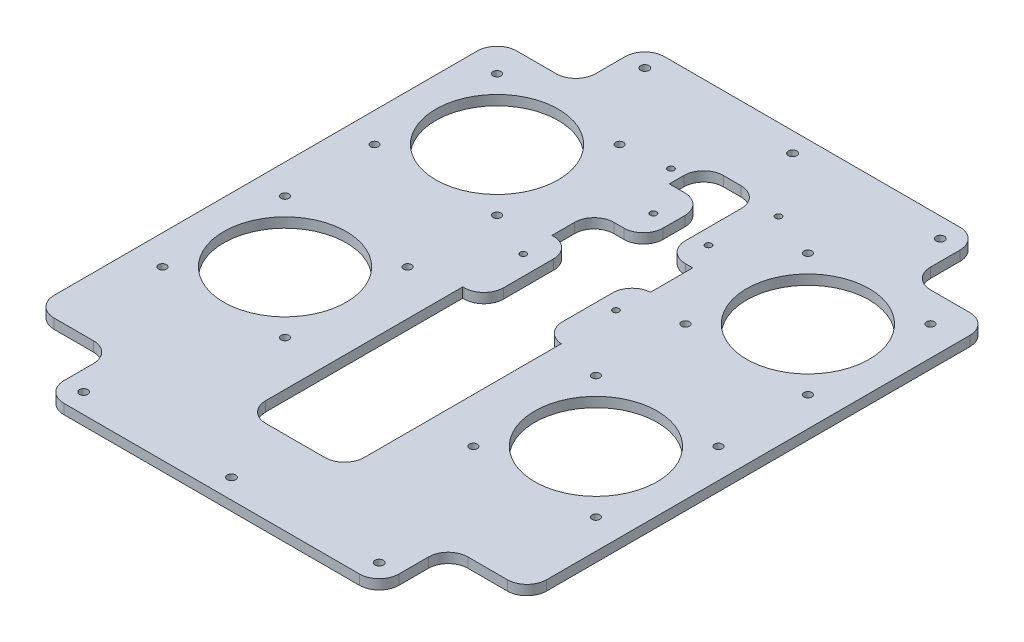
from build123d import *

# Parameters (mm, degrees)
SKETCH1_W           = 279.4
SKETCH1_H           = 304.8
BOSS_EXTRUDE1_DEPTH = 5
CUT_EXTRUDE1_DEPTH  = 10
SKETCH3_R           = 2.125
CUT_EXTRUDE2_DEPTH  = 198.169368818
SKETCH6_R           = 2
SKETCH6_R_2         = 31.1
CUT_EXTRUDE3_DEPTH  = 198.169368818
SKETCH5_R           = 1.5875
CUT_EXTRUDE4_DEPTH  = 10
FILLET1_R           = 10


with BuildPart() as part:
    # Sketch1 → Boss-Extrude1 (new body)
    with BuildSketch(Plane(origin=(0, 0, 0), x_dir=(1, 0, 0), z_dir=(0, 1, 0))):
        Rectangle(SKETCH1_W, SKETCH1_H)
    extrude(amount=BOSS_EXTRUDE1_DEPTH)

    # Sketch2 → Cut-Extrude1 (cut)
    with BuildSketch(Plane(origin=(0, 5, 0), x_dir=(1, 0, 0), z_dir=(0, 1, 0))):
        Polygon((-139.7, 152.4), (-85, 152.4), (-85, 117.4), (-125, 117.4), (-125, -117.4), (-85, -117.4), (-85, -152.4), (-139.7, -152.4), align=None)
        Polygon((139.7, -152.4), (85, -152.4), (85, -117.4), (125, -117.4), (125, 117.4), (85, 117.4), (85, 152.4), (139.7, 152.4), align=None)
    extrude(amount=-CUT_EXTRUDE1_DEPTH, mode=Mode.SUBTRACT)

    # Sketch3 → Cut-Extrude2 (cut, through all)
    with BuildSketch(Plane(origin=(0, 5, 0), x_dir=(1, 0, 0), z_dir=(0, 1, 0))):
        with Locations(Location((-75, 142.4, 0), (0, 0, 270))):
            Circle(SKETCH3_R)
        with Locations(Location((75, 142.4, 0), (0, 0, 270))):
            Circle(SKETCH3_R)
        with Locations(Location((75, -142.4, 0), (0, 0, 270))):
            Circle(SKETCH3_R)
        with Locations(Location((-75, -142.4, 0), (0, 0, 270))):
            Circle(SKETCH3_R)
        with Locations(Location((0, 142.4, 0), (0, 0, 270))):
            Circle(SKETCH3_R)
        with Locations(Location((0, -142.4, 0), (0, 0, 270))):
            Circle(SKETCH3_R)
    extrude(amount=-CUT_EXTRUDE2_DEPTH, mode=Mode.SUBTRACT)

    # Sketch6 → Cut-Extrude3 (cut, through all)
    with BuildSketch(Plane(origin=(0, 5, 0), x_dir=(1, 0, 0), z_dir=(0, 1, 0))):
        with Locations(Location((-110, 102.4, 0), (0, 0, 270))):
            Circle(SKETCH6_R)
        with Locations(Location((-47.8, 102.4, 0), (0, 0, 270))):
            Circle(SKETCH6_R)
        with Locations(Location((-47.8, 40.2, 0), (0, 0, 270))):
            Circle(SKETCH6_R)
        with Locations(Location((-110, 40.2, 0), (0, 0, 270))):
            Circle(SKETCH6_R)
        with Locations(Location((-110, -5.2, 0), (0, 0, 270))):
            Circle(SKETCH6_R)
        with Locations(Location((-47.8, -5.2, 0), (0, 0, 270))):
            Circle(SKETCH6_R)
        with Locations(Location((-47.8, -67.4, 0), (0, 0, 270))):
            Circle(SKETCH6_R)
        with Locations(Location((-110, -67.4, 0), (0, 0, 270))):
            Circle(SKETCH6_R)
        with Locations(Location((-78.9, 71.3, 0), (0, 0, 270))):
            Circle(SKETCH6_R_2)
        with Locations(Location((-78.9, -36.3, 0), (0, 0, 270))):
            Circle(SKETCH6_R_2)
        with Locations(Location((78.9, -36.3, 0), (0, 0, 90))):
            Circle(SKETCH6_R_2)
        with Locations(Location((78.9, 71.3, 0), (0, 0, 90))):
            Circle(SKETCH6_R_2)
        with Locations(Location((110, -67.4, 0), (0, 0, 90))):
            Circle(SKETCH6_R)
        with Locations(Location((47.8, -67.4, 0), (0, 0, 90))):
            Circle(SKETCH6_R)
        with Locations(Location((47.8, -5.2, 0), (0, 0, 90))):
            Circle(SKETCH6_R)
        with Locations(Location((110, -5.2, 0), (0, 0, 90))):
            Circle(SKETCH6_R)
        with Locations(Location((110, 40.2, 0), (0, 0, 90))):
            Circle(SKETCH6_R)
        with Locations(Location((47.8, 40.2, 0), (0, 0, 90))):
            Circle(SKETCH6_R)
        with Locations(Location((47.8, 102.4, 0), (0, 0, 90))):
            Circle(SKETCH6_R)
        with Locations(Location((110, 102.4, 0), (0, 0, 90))):
            Circle(SKETCH6_R)
    extrude(amount=-CUT_EXTRUDE3_DEPTH, mode=Mode.SUBTRACT)

    # Sketch5 → Cut-Extrude4 (cut)
    with BuildSketch(Plane(origin=(0, 5, 0), x_dir=(1, 0, 0), z_dir=(0, 1, 0))):
        with Locations(Location((24.120614372, 111.137541604, 0), (0, 0, 270))):
            Circle(SKETCH5_R)
        with Locations(Location((-24.139385628, 104.787541604, 0), (0, 0, 270))):
            Circle(SKETCH5_R)
        with Locations(Location((-8.899385628, 80.657541604, 0), (0, 0, 270))):
            Circle(SKETCH5_R)
        with Locations(Location((19.040614372, 80.657541604, 0), (0, 0, 270))):
            Circle(SKETCH5_R)
        with Locations(Location((24.120614372, 28.587541604, 0), (0, 0, 270))):
            Circle(SKETCH5_R)
        with Locations(Location((-24.139385628, 29.857541604, 0), (0, 0, 270))):
            Circle(SKETCH5_R)
        Polygon((0, 66.727836804), (-25, 66.727836804), (-25, 45.310060528), (-14.26649767, 45.310060528), (-14.26649767, 0), (-25, 0), (-25, -110), (25, -110), (25, 0), (15.644534715, 0), (15.644534715, 45.310060528), (25, 45.310060528), (25, 66.727836804), (11.213270658, 66.727836804), (11.213270658, 115.102469427), (0, 115.102469427), (-17.849370469, 115.102469427), (-17.849370469, 97.688471773), (0, 97.688471773), align=None)
    extrude(amount=-CUT_EXTRUDE4_DEPTH, mode=Mode.SUBTRACT)

    # Fillet1
    # the kernel refuses this fillet: 10 mm, written as the material it adds along each edge
    with BuildSketch(Plane(origin=(-85, 5, -117.4), x_dir=(0, 0, -1), z_dir=(0, -1, 0)), Plane(origin=(-85, 5, 117.4), x_dir=(-1, 0, 0), z_dir=(0, -1, 0)), Plane(origin=(-17.849370469, 5, -115.102469427), x_dir=(0, 0, 1), z_dir=(0, -1, 0)), Plane(origin=(11.213270658, 5, -115.102469427), x_dir=(-1, 0, 0), z_dir=(0, -1, 0)), Plane(origin=(25, 5, 110), x_dir=(0, 0, -1), z_dir=(0, -1, 0)), Plane(origin=(-25, 5, 110), x_dir=(1, 0, 0), z_dir=(0, -1, 0))) as fillet1_piece_1:
        with BuildLine():
            CenterArc((FILLET1_R, -FILLET1_R), FILLET1_R, 90, 90)
            Line((0, -FILLET1_R), (0, 0))
            Line((0, 0), (FILLET1_R, 0))
        make_face()
    extrude(amount=5)
    with BuildSketch(Plane(origin=(-25, 5, -66.727836804), x_dir=(1, 0, 0), z_dir=(0, -1, 0)), Plane(origin=(85, 5, 117.4), x_dir=(1, 0, 0), z_dir=(0, -1, 0)), Plane(origin=(85, 5, -117.4), x_dir=(0, 0, -1), z_dir=(0, -1, 0))) as fillet1_piece_2:
        with BuildLine():
            CenterArc((FILLET1_R, FILLET1_R), FILLET1_R, 180, 90)
            Line((0, FILLET1_R), (0, 0))
            Line((0, 0), (FILLET1_R, 0))
        make_face()
    extrude(amount=5)
    # the kernel refuses this fillet: 10 mm, written as the material it takes off along each edge
    with BuildSketch(Plane(origin=(-85, 30, -152.4), x_dir=(1, 0, 0), z_dir=(0, -1, 0)), Plane(origin=(-125, 30, -117.4), x_dir=(1, 0, 0), z_dir=(0, -1, 0)), Plane(origin=(-125, 30, 117.4), x_dir=(0, 0, -1), z_dir=(0, -1, 0)), Plane(origin=(-85, 30, 152.4), x_dir=(0, 0, -1), z_dir=(0, -1, 0)), Plane(origin=(-14.26649767, 30, 0), x_dir=(-1, 0, 0), z_dir=(0, -1, 0)), Plane(origin=(-14.26649767, 30, -45.310060528), x_dir=(0, 0, 1), z_dir=(0, -1, 0)), Plane(origin=(0, 30, -66.727836804), x_dir=(-1, 0, 0), z_dir=(0, -1, 0)), Plane(origin=(0, 30, -97.688471773), x_dir=(0, 0, 1), z_dir=(0, -1, 0)), Plane(origin=(11.213270658, 30, -66.727836804), x_dir=(0, 0, -1), z_dir=(0, -1, 0)), Plane(origin=(85, 30, 152.4), x_dir=(-1, 0, 0), z_dir=(0, -1, 0))) as fillet1_2_piece_1:
        with BuildLine():
            CenterArc((FILLET1_R, FILLET1_R), FILLET1_R, 180, 90)
            Line((0, FILLET1_R), (0, 0))
            Line((0, 0), (FILLET1_R, 0))
        make_face()
    extrude(amount=55, mode=Mode.SUBTRACT)
    with BuildSketch(Plane(origin=(15.644534715, 29.948017832, -45.310060528), x_dir=(1, 0, 0), z_dir=(0, -1, 0))) as fillet1_2_piece_2:
        with BuildLine():
            CenterArc((10, 9.979207133), FILLET1_R, 180, 86.304526435)
            Line((0, 9.979207133), (0, 0))
            Line((0, 0), (9.355465285, 0))
        make_face()
    extrude(amount=54.896035664, mode=Mode.SUBTRACT)
    with BuildSketch(Plane(origin=(15.644534715, 29.948017832, 0), x_dir=(0, 0, -1), z_dir=(0, -1, 0))) as fillet1_2_piece_3:
        with BuildLine():
            CenterArc((9.979207133, 10), FILLET1_R, 183.695473565, 86.304526435)
            Line((0, 9.355465285), (0, 0))
            Line((0, 0), (9.979207133, 0))
        make_face()
    extrude(amount=54.896035664, mode=Mode.SUBTRACT)
    with BuildSketch(Plane(origin=(125, 30, 117.4), x_dir=(0, 0, -1), z_dir=(0, -1, 0)), Plane(origin=(125, 30, -117.4), x_dir=(-1, 0, 0), z_dir=(0, -1, 0)), Plane(origin=(85, 30, -152.4), x_dir=(-1, 0, 0), z_dir=(0, -1, 0))) as fillet1_2_piece_4:
        with BuildLine():
            CenterArc((FILLET1_R, -FILLET1_R), FILLET1_R, 90, 90)
            Line((0, -FILLET1_R), (0, 0))
            Line((0, 0), (FILLET1_R, 0))
        make_face()
    extrude(amount=55, mode=Mode.SUBTRACT)


solid = part.part
